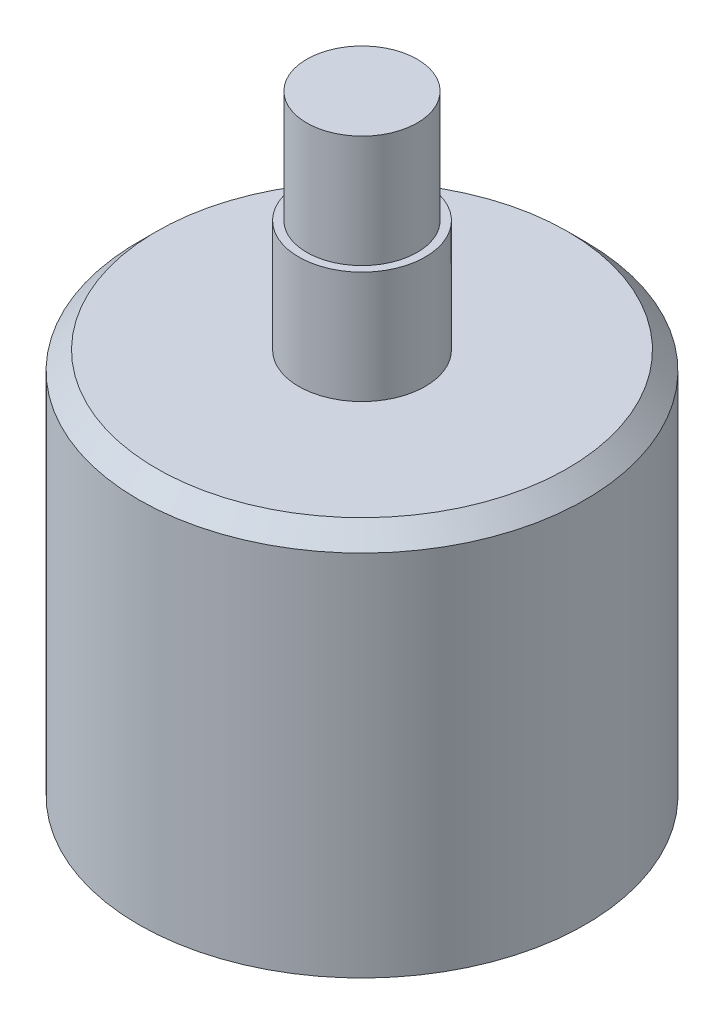
from build123d import *

# Parameters (mm, degrees)
SKETCH2_R          = 1.2573
CUT_EXTRUDE1_DEPTH = 3.175


with BuildPart() as part:
    # Sketch1 → Revolve1 (revolve)
    with BuildSketch(Plane.XY):
        Polygon((0, 40.7), (3.45, 40.7), (3.45, 33.7), (3.95, 33.7), (3.95, 26.7), (12.827467985, 26.7), (13.95, 25.577467985), (13.95, 2.6), (3, 2.6), (3, 0), (0, 0), align=None)
    revolve(axis=Axis((0, 0, 0), (0, 1, 0)))

    # Sketch2 → Cut-Extrude1 (cut)
    with BuildSketch(Plane.XZ.offset(-2.6)):
        with Locations((-9.5, 0)):
            Circle(SKETCH2_R)
        with Locations((0, -8)):
            Circle(SKETCH2_R)
        with Locations((9.5, 0)):
            Circle(SKETCH2_R)
        with Locations((0, 8)):
            Circle(SKETCH2_R)
    extrude(amount=-CUT_EXTRUDE1_DEPTH, mode=Mode.SUBTRACT)


solid = part.part
